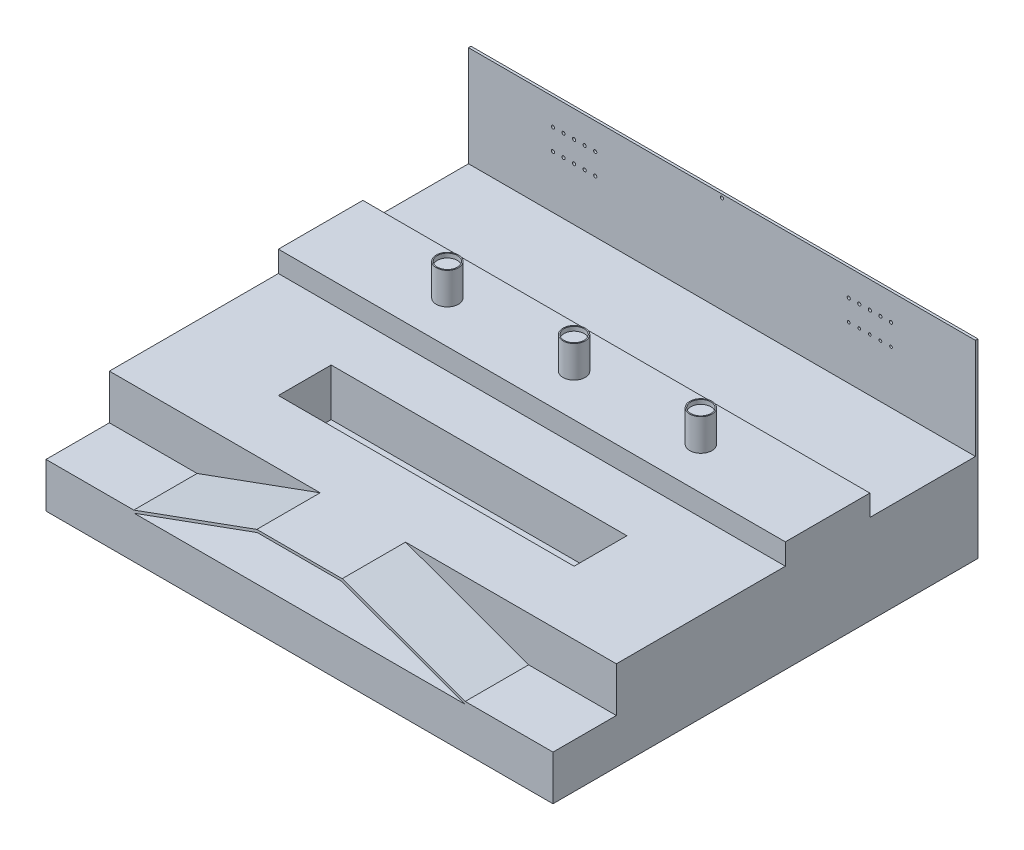
from build123d import *

# Parameters (mm, degrees)
EXTRUDE_1_DEPTH     = 300
SKETCH_2_W          = 2400
SKETCH_2_H          = 224
EXTRUDE_2_DEPTH     = 800
SKETCH_4_W          = 1400
SKETCH_4_H          = 250
CUT_EXTRUDE_1_DEPTH = 1460.512247294
SKETCH_7_W          = 2400
SKETCH_7_H          = 324
EXTRUDE_3_DEPTH     = 400
SKETCH_9_W          = 2400
SKETCH_9_H          = 224
EXTRUDE_5_DEPTH     = 500
SKETCH_10_W         = 2400
SKETCH_10_H         = 700
EXTRUDE_6_DEPTH     = 12
SKETCH_12_W         = 2400
SKETCH_12_H         = 2012
EXTRUDE_8_DEPTH     = 200
SKETCH_13_R         = 52.5
EXTRUDE_9_DEPTH     = 150
SKETCH_14_R         = 7.5
SKETCH_14_R_2       = 6.5
CUT_EXTRUDE_2_DEPTH = 2383.885645599
SKETCH_16_R         = 47.5
CUT_EXTRUDE_3_DEPTH = 20


with BuildPart() as part:
    # 草图1 → 凸台-拉伸1 (new body)
    with BuildSketch(Plane.XY):
        Polygon((-200, 0), (200, 0), (782.465212924, -212), (1200, -212), (1200, -200), (784.581136693, -200), (202.115923769, 12), (-202.115923769, 12), (-784.581136693, -200), (-1200, -200), (-1200, -212), (-782.465212924, -212), align=None)
    extrude(amount=EXTRUDE_1_DEPTH)

    # 草图2 → 凸台-拉伸2 (add)
    with BuildSketch(Plane(origin=(0, 0, 0), x_dir=(-1, 0, 0), z_dir=(0, 0, -1))):
        with Locations((0, -100)):
            Rectangle(SKETCH_2_W, SKETCH_2_H)
    extrude(amount=EXTRUDE_2_DEPTH)

    # 草图4 → 切除-拉伸1 (cut, through all)
    with BuildSketch(Plane(origin=(0, 12, 0), x_dir=(1, 0, 0), z_dir=(0, 1, 0))):
        with Locations((0, 425)):
            Rectangle(SKETCH_4_W, SKETCH_4_H)
    extrude(amount=-CUT_EXTRUDE_1_DEPTH, mode=Mode.SUBTRACT)

    # 草图7 → 凸台-拉伸3 (add)
    with BuildSketch(Plane(origin=(0, 0, -800), x_dir=(-1, 0, 0), z_dir=(0, 0, -1))):
        with Locations((0, -50)):
            Rectangle(SKETCH_7_W, SKETCH_7_H)
    extrude(amount=EXTRUDE_3_DEPTH)

    # 草图9 → 凸台-拉伸5 (add)
    with BuildSketch(Plane(origin=(0, 0, -1200), x_dir=(-1, 0, 0), z_dir=(0, 0, -1))):
        with Locations((0, -100)):
            Rectangle(SKETCH_9_W, SKETCH_9_H)
    extrude(amount=EXTRUDE_5_DEPTH)

    # 草图10 → 凸台-拉伸6 (add)
    with BuildSketch(Plane(origin=(0, 0, -1700), x_dir=(-1, 0, 0), z_dir=(0, 0, -1))):
        with Locations((0, 138)):
            Rectangle(SKETCH_10_W, SKETCH_10_H)
    extrude(amount=EXTRUDE_6_DEPTH)

    # 草图12 → 凸台-拉伸8 (add)
    with BuildSketch(Plane.XZ.offset(212)):
        with Locations((0, -706)):
            Rectangle(SKETCH_12_W, SKETCH_12_H)
    extrude(amount=EXTRUDE_8_DEPTH)

    # 草图13 → 凸台-拉伸9 (add)
    with BuildSketch(Plane(origin=(0, 112, 0), x_dir=(1, 0, 0), z_dir=(0, 1, 0))):
        with Locations((-600, 1000)):
            Circle(SKETCH_13_R)
        with Locations((600, 1000)):
            Circle(SKETCH_13_R)
        with Locations((0, 1000)):
            Circle(SKETCH_13_R)
    extrude(amount=EXTRUDE_9_DEPTH)

    # 草图14 → 切除-拉伸2 (cut, through all)
    with BuildSketch(Plane.XY.offset(-1700)):
        with Locations((-800, 262)):
            Circle(SKETCH_14_R)
        with Locations((800, 362)):
            Circle(SKETCH_14_R)
        with Locations((-750, 262)):
            Circle(SKETCH_14_R)
        with Locations((-700, 262)):
            Circle(SKETCH_14_R)
        with Locations((-650, 262)):
            Circle(SKETCH_14_R)
        with Locations((-600, 262)):
            Circle(SKETCH_14_R)
        with Locations((750, 362)):
            Circle(SKETCH_14_R)
        with Locations((700, 362)):
            Circle(SKETCH_14_R)
        with Locations((650, 362)):
            Circle(SKETCH_14_R)
        with Locations((600, 362)):
            Circle(SKETCH_14_R)
        with Locations((0, 472)):
            Circle(SKETCH_14_R)
        with Locations((-800, 362)):
            Circle(SKETCH_14_R)
        with Locations((-750, 362)):
            Circle(SKETCH_14_R)
        with Locations((-700, 362)):
            Circle(SKETCH_14_R)
        with Locations((-650, 362)):
            Circle(SKETCH_14_R)
        with Locations((-600, 362)):
            Circle(SKETCH_14_R)
        with Locations((800, 262)):
            Circle(SKETCH_14_R_2)
        with Locations((750, 262)):
            Circle(SKETCH_14_R_2)
        with Locations((700, 262)):
            Circle(SKETCH_14_R_2)
        with Locations((650, 262)):
            Circle(SKETCH_14_R_2)
        with Locations((600, 262)):
            Circle(SKETCH_14_R_2)
    extrude(amount=-CUT_EXTRUDE_2_DEPTH, mode=Mode.SUBTRACT)

    # 草图16 → 切除-拉伸3 (cut)
    with BuildSketch(Plane(origin=(0, 262, 0), x_dir=(1, 0, 0), z_dir=(0, 1, 0))):
        with Locations((-600, 1000)):
            Circle(SKETCH_16_R)
        with Locations((0, 1000)):
            Circle(SKETCH_16_R)
        with Locations((600, 1000)):
            Circle(SKETCH_16_R)
    extrude(amount=-CUT_EXTRUDE_3_DEPTH, mode=Mode.SUBTRACT)


solid = part.part
